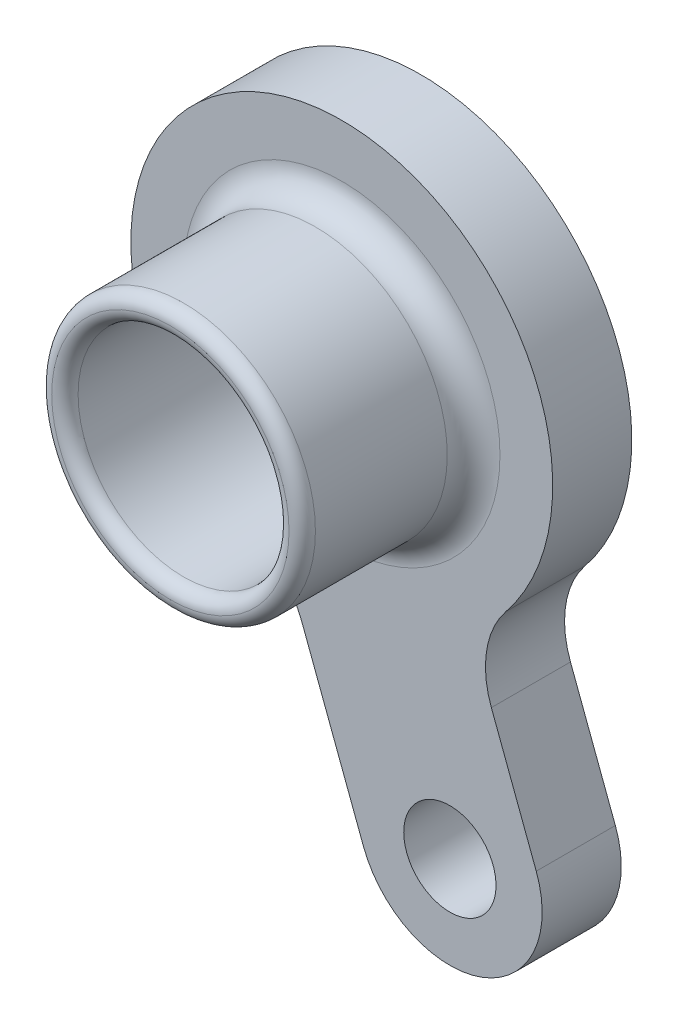
from build123d import *

# Parameters (mm, degrees)
ESQUISSE1_R             = 8
ESQUISSE1_R_2           = 5
BOSS_EXTRU_1_DEPTH      = 3
BOSS_EXTRU_2_DEPTH      = 6.5
BOSS_EXTRU_2_DEPTH_BACK = 0.25
ESQUISSE2_R             = 5
ESQUISSE2_R_2           = 4
CONG_2_R                = 0.5
ESQUISSE4_R             = 1.75
BOSS_EXTRU_4_DEPTH      = 3
CONG_3_R                = 3.5
CONG_4_R                = 1


with BuildPart() as part:
    # Esquisse1 → Boss.-Extru.1 (new body)
    with BuildSketch(Plane.XY):
        Circle(ESQUISSE1_R)
        Circle(ESQUISSE1_R_2, mode=Mode.SUBTRACT)
    extrude(amount=BOSS_EXTRU_1_DEPTH)

    # Esquisse2 → Boss.-Extru.2 (add, two sides: drawn at the far end of the back side and taken through both)
    with BuildSketch(Plane.XY.offset(3).offset(-BOSS_EXTRU_2_DEPTH_BACK)):
        Circle(ESQUISSE2_R)
        Circle(ESQUISSE2_R_2, mode=Mode.SUBTRACT)
    extrude(amount=BOSS_EXTRU_2_DEPTH + BOSS_EXTRU_2_DEPTH_BACK)

    # Congé2
    cong_2_edges = [part.edges().sort_by_distance(p)[0] for p in [
        (-5, 0, 2.75),
        (-4, 0, 2.75),
        (-4, 0, 9.5),
        (-5, 0, 9.5),
    ]]
    fillet(cong_2_edges, radius=CONG_2_R - 0.0001)  # a hair under: the kernel refuses the full size

    # Esquisse4 → Boss.-Extru.4 (add)
    with BuildSketch(Plane.XY):
        with BuildLine():
            ThreePointArc((4.877548317, -6.341097887), (1.559913464, -7.846443142), (-2.081227097, -7.724538418))
            Line((-2.081227097, -7.724538418), (2.057501229, -18.71868038))
            Line((2.057501229, -18.71868038), (8.60868038, -16.252498771))
            Line((8.60868038, -16.252498771), (4.877548317, -6.341097887))
        make_face()
        with Locations(Location((4.1, -14.21, 0), (0, 0, 180))):
            Circle(ESQUISSE4_R, mode=Mode.SUBTRACT)
    extrude(amount=BOSS_EXTRU_4_DEPTH)

    # Congé3
    cong_3_edges = [part.edges().sort_by_distance(p)[0] for p in [
        (4.877548317, -6.341097887, 1.5),
        (-2.081227097, -7.724538418, 1.5),
        (2.057501229, -18.71868038, 1.5),
        (8.60868038, -16.252498771, 1.5),
    ]]
    fillet(cong_3_edges, radius=CONG_3_R - 0.0001)  # a hair under: the kernel refuses the full size

    # Congé4
    cong_4_edges = [part.edges().sort_by_distance(p)[0] for p in [
        (-5, 0, 3),
    ]]
    fillet(cong_4_edges, radius=CONG_4_R)


solid = part.part
